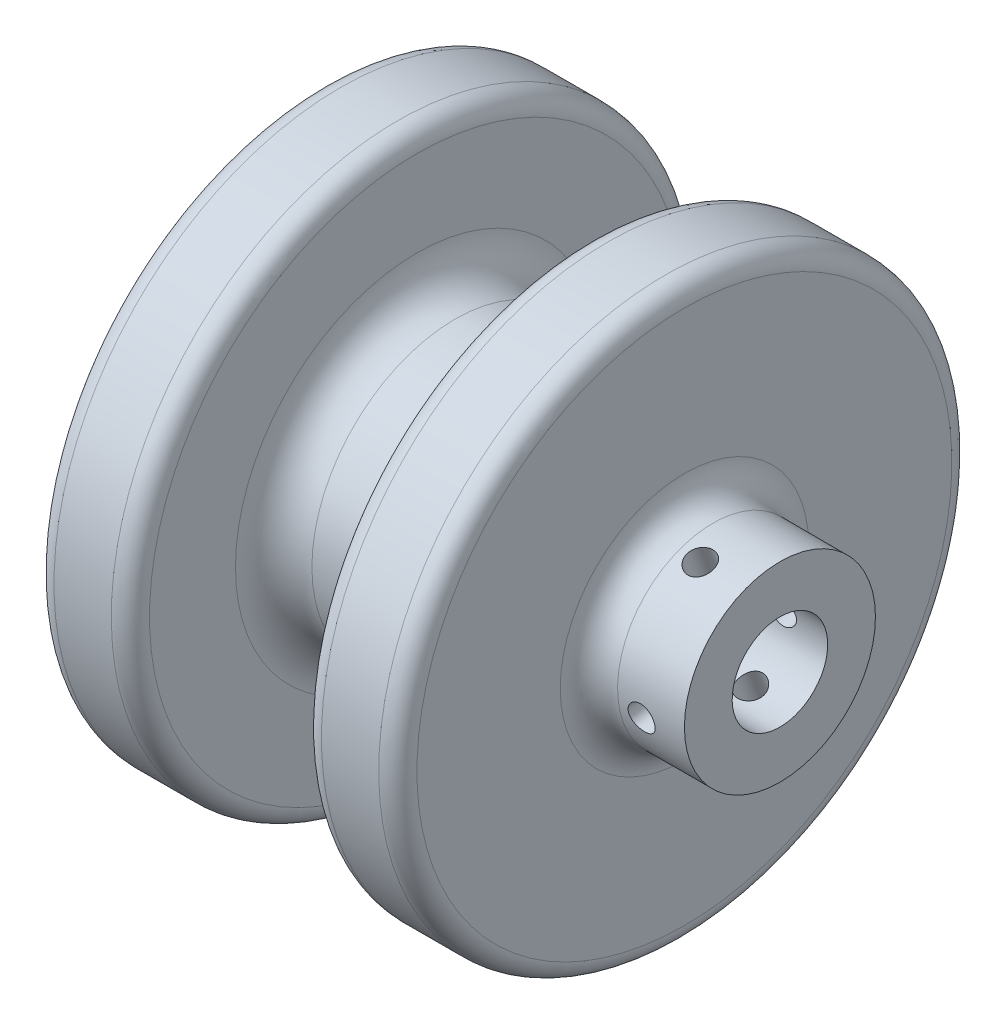
from build123d import *

# Parameters (mm, degrees)
FILLET1_R                           = 4
FILLET2_R                           = 2
SKETCH2_R                           = 10
BOSS_EXTRUDE1_DEPTH                 = 10
FILLET3_R                           = 3
SKETCH3_R                           = 5
CUT_EXTRUDE1_DEPTH                  = 65.062469606
F_1_0MM_DOWEL_HOLE1_D               = 2.8
F_1_0MM_DOWEL_HOLE1_DEPTH           = 33.158795133
F_1_0MM_DOWEL_HOLE1_TIP             = 0.841204867
F_1_0MM_DOWEL_HOLE1_ON_FACE_2_D     = 2.8
F_1_0MM_DOWEL_HOLE1_ON_FACE_2_DEPTH = 33.158795133
F_1_0MM_DOWEL_HOLE1_ON_FACE_2_TIP   = 0.841204867


with BuildPart() as part:
    # Sketch1 → Revolve1 (revolve)
    with BuildSketch(Plane.XY):
        Polygon((-19, 0), (19, 0), (19, 30), (9, 30), (9, 15), (-9, 15), (-9, 30), (-19, 30), align=None)
    revolve(axis=Axis((-19, 0, 0), (1, 0, 0)))

    # Fillet1
    fillet1_edges = [part.edges().sort_by_distance(p)[0] for p in [
        (9, -15, 0),
        (-9, -15, 0),
    ]]
    fillet(fillet1_edges, radius=FILLET1_R)

    # Fillet2
    fillet2_edges = [part.edges().sort_by_distance(p)[0] for p in [
        (-9, -30, 0),
        (-19, -30, 0),
        (19, -30, 0),
        (9, -30, 0),
    ]]
    fillet(fillet2_edges, radius=FILLET2_R)

    # Sketch2 → Boss-Extrude1 (add)
    with BuildSketch(Plane(origin=(19, 0, 0), x_dir=(0, 0, -1), z_dir=(1, 0, 0))):
        Circle(SKETCH2_R)
    extrude(amount=BOSS_EXTRUDE1_DEPTH)

    # Fillet3
    fillet3_edges = [part.edges().sort_by_distance(p)[0] for p in [
        (19, 0, 10),
    ]]
    fillet(fillet3_edges, radius=FILLET3_R)

    # Sketch3 → Cut-Extrude1 (cut, through all)
    with BuildSketch(Plane(origin=(29, 0, 0), x_dir=(0, 0, -1), z_dir=(1, 0, 0))):
        Circle(SKETCH3_R)
    extrude(amount=-CUT_EXTRUDE1_DEPTH, mode=Mode.SUBTRACT)

    # Ø1.0mm Dowel Hole1
    with Locations(Plane(origin=(24.178674036, 9.356696283, 3.528772402), x_dir=(0, -0.352877240247, 0.935669628296), z_dir=(0, 0.935669628296, 0.352877240247))):
        with Locations((0, 0)):
            Hole(F_1_0MM_DOWEL_HOLE1_D / 2, depth=F_1_0MM_DOWEL_HOLE1_DEPTH)
            with Locations((0, 0, -(F_1_0MM_DOWEL_HOLE1_DEPTH + F_1_0MM_DOWEL_HOLE1_TIP / 2))):  # 118° drill point
                Cone(0, F_1_0MM_DOWEL_HOLE1_D / 2, F_1_0MM_DOWEL_HOLE1_TIP, mode=Mode.SUBTRACT)

    # Ø1.0mm Dowel Hole1 on face 2
    with Locations(Plane(origin=(24.391872748, 1.579563505, -9.874460954), x_dir=(0, -0.987446147696, -0.157956023626), z_dir=(0, 0.157956023626, -0.987446147696))):
        with Locations((0, 0)):
            Hole(F_1_0MM_DOWEL_HOLE1_ON_FACE_2_D / 2, depth=F_1_0MM_DOWEL_HOLE1_ON_FACE_2_DEPTH)
            with Locations((0, 0, -(F_1_0MM_DOWEL_HOLE1_ON_FACE_2_DEPTH + F_1_0MM_DOWEL_HOLE1_ON_FACE_2_TIP / 2))):  # 118° drill point
                Cone(0, F_1_0MM_DOWEL_HOLE1_ON_FACE_2_D / 2, F_1_0MM_DOWEL_HOLE1_ON_FACE_2_TIP, mode=Mode.SUBTRACT)


solid = part.part
